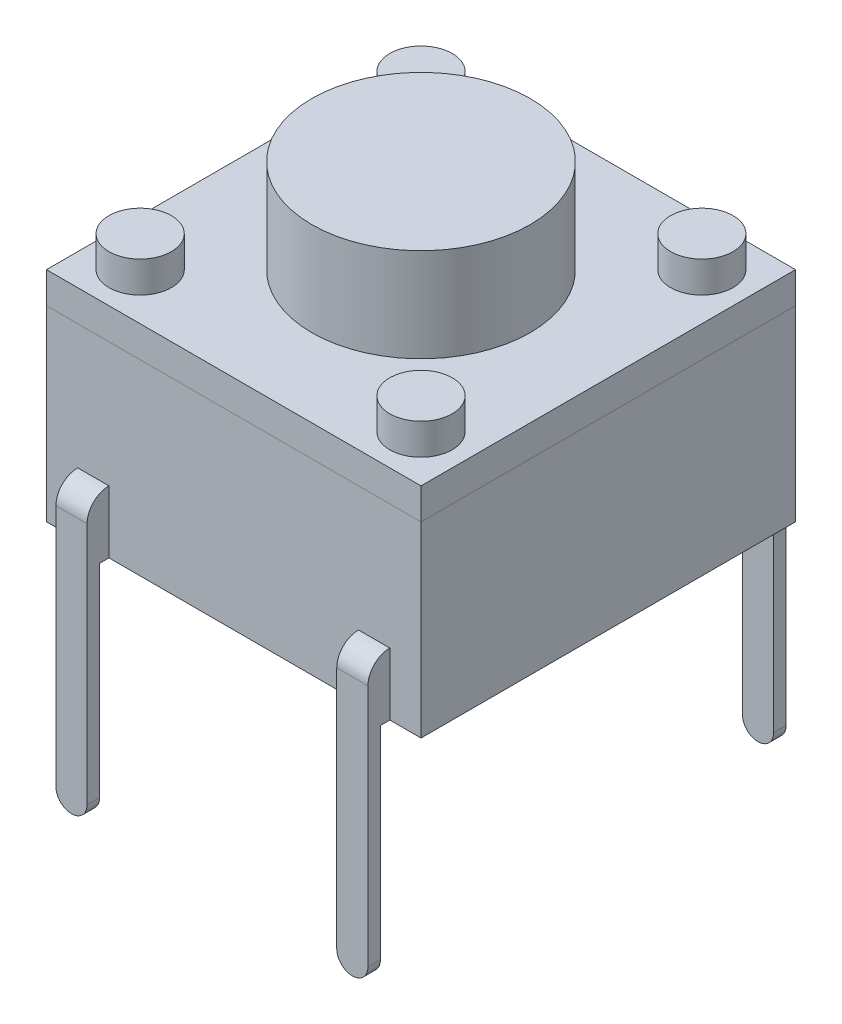
from build123d import *

# Parameters (mm, degrees)
CROQUIS3_W               = 6
CROQUIS3_H               = 6
SALIENTE_EXTRUIR4_DEPTH  = 3
CROQUIS6_W               = 6.001
CROQUIS6_H               = 6.001
SALIENTE_EXTRUIR9_DEPTH  = 0.5
CROQUIS7_R               = 0.5
SALIENTE_EXTRUIR10_DEPTH = 0.5
CROQUIS7_3_R             = 1.75
SALIENTE_EXTRUIR11_DEPTH = 1.5
SALIENTE_EXTRUIR12_DEPTH = 0.35
REDONDEO3_R              = 0.35
REDONDEO3_OF_SIMETR_A4_R = 0.35
CROQUIS11_W              = 6
CROQUIS11_H              = 6.3
CORTAR_EXTRUIR1_DEPTH    = 6.2


with BuildPart() as part:
    # Croquis3 → Saliente-Extruir4 (new body)
    with BuildSketch(Plane(origin=(0, 0, 0), x_dir=(1, 0, 0), z_dir=(0, 1, 0))):
        Rectangle(CROQUIS3_W, CROQUIS3_H)
    extrude(amount=SALIENTE_EXTRUIR4_DEPTH)

    # Croquis6 → Saliente-Extruir9 (add)
    with BuildSketch(Plane(origin=(0, 3, 0), x_dir=(1, 0, 0), z_dir=(0, 1, 0))):
        Rectangle(CROQUIS6_W, CROQUIS6_H)
    extrude(amount=SALIENTE_EXTRUIR9_DEPTH)

    # Croquis7 → Saliente-Extruir10 (add)
    with BuildSketch(Plane(origin=(0, 3.5, 0), x_dir=(1, 0, 0), z_dir=(0, 1, 0))):
        with Locations(Location((-2.25, -2.25, 0), (0, 0, 270))):
            Circle(CROQUIS7_R)
        with Locations(Location((-2.25, 2.25, 0), (0, 0, 270))):
            Circle(CROQUIS7_R)
        with Locations(Location((2.25, 2.25, 0), (0, 0, 270))):
            Circle(CROQUIS7_R)
        with Locations(Location((2.25, -2.25, 0), (0, 0, 270))):
            Circle(CROQUIS7_R)
    extrude(amount=SALIENTE_EXTRUIR10_DEPTH)

    # Croquis7<3> → Saliente-Extruir11 (add)
    with BuildSketch(Plane(origin=(0, 3.5, 0), x_dir=(1, 0, 0), z_dir=(0, 1, 0))):
        with Locations(Location((0, 0, 0), (0, 0, 270))):
            Circle(CROQUIS7_3_R)
    extrude(amount=SALIENTE_EXTRUIR11_DEPTH)

    # Croquis8 → Saliente-Extruir12 (add)
    with BuildSketch(Plane.XY.offset(3)):
        with BuildLine():
            Line((-2.5, 1), (-2, 1))
            Line((-2, 1), (-2, -3.25))
            ThreePointArc((-2, -3.25), (-2.25, -3.5), (-2.5, -3.25))
            Line((-2.5, -3.25), (-2.5, 1))
        make_face()
        with BuildLine():
            Line((2, 1), (2, -3.25))
            ThreePointArc((2, -3.25), (2.25, -3.5), (2.5, -3.25))
            Line((2.5, -3.25), (2.5, 1))
            Line((2.5, 1), (2, 1))
        make_face()
    saliente_extruir12 = extrude(amount=SALIENTE_EXTRUIR12_DEPTH)

    # Redondeo3
    redondeo3_edges = [part.edges().sort_by_distance(p)[0] for p in [
        (-2.25, 1, 3.35),
        (2.25, 1, 3.35),
    ]]
    fillet(redondeo3_edges, radius=REDONDEO3_R - 0.0001)  # a hair under: the kernel refuses the full size

    # Simetría4: Saliente-Extruir12 across plane
    add(saliente_extruir12.mirror(Plane.XY))

    # Redondeo3 of Simetría4
    redondeo3_of_simetr_a4_edges = [part.edges().sort_by_distance(p)[0] for p in [
        (-2.25, 1, -3.35),
        (2.25, 1, -3.35),
    ]]
    fillet(redondeo3_of_simetr_a4_edges, radius=REDONDEO3_OF_SIMETR_A4_R - 0.0001)  # a hair under: the kernel refuses the full size

    # Croquis11 → Cortar-Extruir1 (cut)
    with BuildSketch(Plane.XZ):
        Rectangle(CROQUIS11_W, CROQUIS11_H)
    extrude(amount=CORTAR_EXTRUIR1_DEPTH, mode=Mode.SUBTRACT)


solid = part.part
